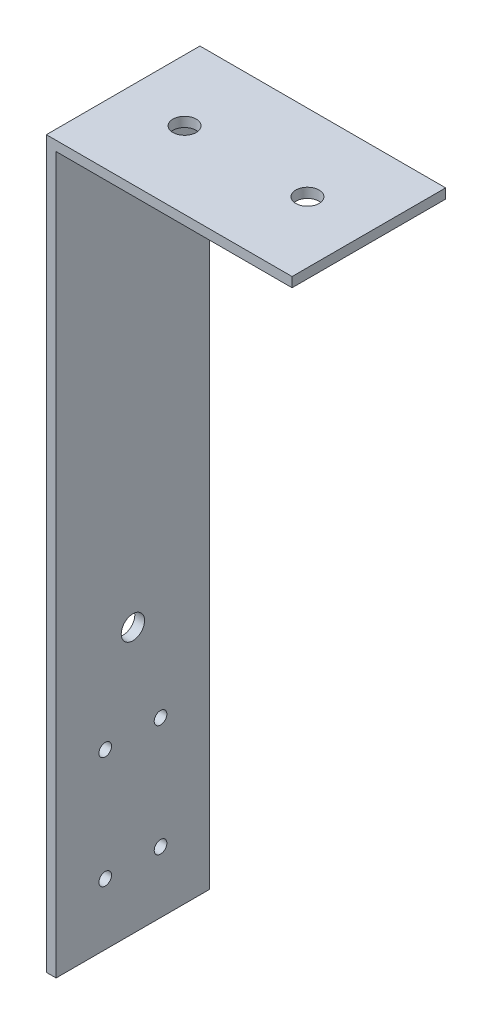
from build123d import *

# Parameters (mm, degrees)
BOSS_EXTRUDE1_DEPTH   = 25
F_6_CLEARANCE_HOLE1_D = 3.7973
F_1_CLEARANCE_HOLE2_D = 2.0574
F_6_CLEARANCE_HOLE2_D = 3.7973


with BuildPart() as part:
    # Sketch2 → Boss-Extrude1 (new body)
    with BuildSketch(Plane.XY):
        Polygon((0, 0), (0, 118.1), (40, 118.1), (40, 116.5125), (1.5875, 116.5125), (1.5875, 0), align=None)
    extrude(amount=BOSS_EXTRUDE1_DEPTH)

    # #6 Clearance Hole1 (through all)
    with Locations(Plane(origin=(0, 118.1, 0), x_dir=(1, 0, 0), z_dir=(0, 1, 0))):
        with Locations((10, -12.5), (30, -12.5)):
            Hole(F_6_CLEARANCE_HOLE1_D / 2)

    # #1 Clearance Hole2 (through all)
    with Locations(Plane.ZY):
        with Locations((17, 10), (17, 28.2), (8, 10), (8, 28.2)):
            Hole(F_1_CLEARANCE_HOLE2_D / 2)

    # #6 Clearance Hole2 (through all)
    with Locations(Plane.ZY):
        with Locations((12.5, 43.2)):
            Hole(F_6_CLEARANCE_HOLE2_D / 2)


solid = part.part
